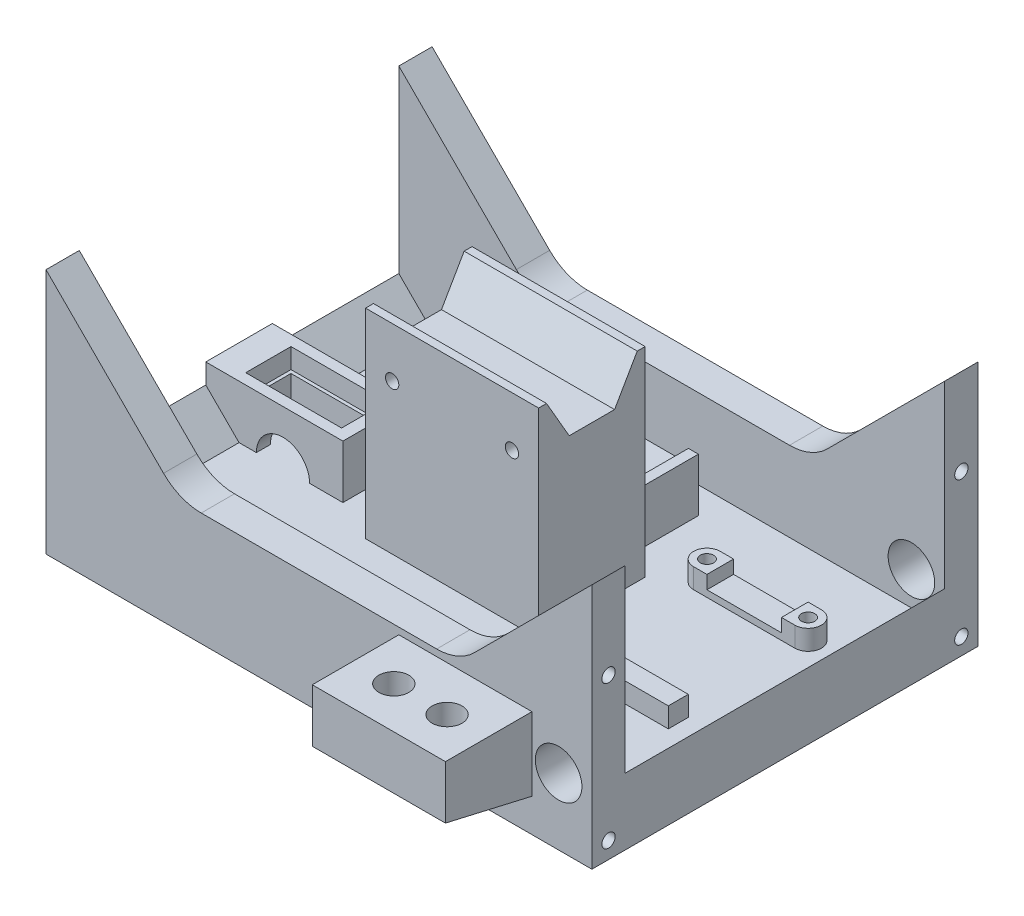
from build123d import *

# Parameters (mm, degrees)
RESSALTO_EXTRUS_O1_DEPTH  = 29
CORTE_EXTRUS_O1_REACH     = 115.6
ESBO_O2_R                 = 6.5
ESBO_O3_R                 = 18
CORTE_EXTRUS_O2_DEPTH     = 2.5
CORTE_EXTRUS_O3_START     = -5
ESBO_O5_R                 = 2
ESBO_O5_R_2               = 1.5
CORTE_EXTRUS_O3_DEPTH     = 5
ESBO_O7_R                 = 12
ESBO_O7_R_2               = 2
CORTE_EXTRUS_O4_DEPTH     = 110.590145542
ESBO_O11_W                = 18
ESBO_O11_H                = 10
RESSALTO_EXTRUS_O3_DEPTH  = 8
ESBO_O12_W                = 14.4
ESBO_O12_H                = 6.8
CORTE_EXTRUS_O6_DEPTH     = 3
ESBO_O13_W                = 13.4
ESBO_O13_H                = 5.8
CORTE_EXTRUS_O7_DEPTH     = 5
CORTE_EXTRUS_O8_REACH     = 84.898
RESSALTO_EXTRUS_O4_DEPTH  = 5
ESBO_O17_W                = 2.6
ESBO_O17_H                = 10
RESSALTO_EXTRUS_O5_DEPTH  = 8
CHANFRO1_SIZE             = 5
FILETE1_R                 = 8
ESBO_O18_W                = 20
ESBO_O18_H                = 8
RESSALTO_EXTRUS_O6_DEPTH  = 13
ESBO_O19_R                = 2.25
CORTE_EXTRUS_O9_DEPTH     = 80.252760204
CHANFRO2_SIZE             = 3
CHANFRO2_SIZE_2           = 13
CORTE_EXTRUS_O10_START    = -6
CORTE_EXTRUS_O10_DEPTH    = 74.252760204
ESBO_O21_W                = 26
ESBO_O21_H                = 16
RESSALTO_EXTRUS_O7_DEPTH  = 30
CORTE_EXTRUS_O11_DEPTH    = 26
ESBO_O24_R                = 1
ESBO_O24_W                = 17.2
ESBO_O24_H                = 3
RESSALTO_EXTRUS_O8_DEPTH  = 3
ESBO_O25_W                = 11.2
ESBO_O25_H                = 4
CORTE_EXTRUS_O12_DEPTH    = 2
ESBO_O26_R                = 3.5
CORTE_EXTRUS_O13_DEPTH    = 5
ESBO_O27_W                = 24
ESBO_O27_H                = 8
RESSALTO_EXTRUS_O9_DEPTH  = 6
ESBO_O28_W                = 1.5
ESBO_O28_H                = 8
RESSALTO_EXTRUS_O10_DEPTH = 2
ESBO_O31_R                = 1
CORTE_EXTRUS_O14_DEPTH    = 85.172442046
ESBO_O32_R                = 1
CORTE_EXTRUS_O15_DEPTH    = 12
ESBO_O33_R                = 1.25
CORTE_EXTRUS_O16_DEPTH    = 5
CORTE_EXTRUS_O17_DEPTH    = 2
ESBO_O38_R                = 62.548775677
CORTE_EXTRUS_O20_DEPTH    = 114.723348526
ESBO_O39_R                = 54.583555182
CORTE_EXTRUS_O21_DEPTH    = 110.945441015


with BuildPart() as part:
    # Esboço1 → Ressalto-extrusão1 (new, symmetric)
    with BuildSketch(Plane.XY):
        Polygon((0, 0), (-41, 0), (-41, 60), (-46, 60), (-46, -5), (46, -5), (46, 60), (41, 60), (41, 0), align=None)
    extrude(amount=RESSALTO_EXTRUS_O1_DEPTH, both=True)

    # Esboço2 → Corte-extrusão1 (cut, up to next)
    with BuildSketch(Plane.ZY.offset(46), mode=Mode.PRIVATE) as corte_extrus_o1_sk1:
        with Locations(Location((0, 30, 0), (0, 0, 270))):
            Circle(ESBO_O2_R)
    corte_extrus_o1_tool1 = extrude(corte_extrus_o1_sk1.sketch, amount=-CORTE_EXTRUS_O1_REACH, mode=Mode.PRIVATE) & part.part
    add(corte_extrus_o1_tool1.solids().sort_by_distance((-46, 30, 0))[0], mode=Mode.SUBTRACT)

    # Esboço3 → Corte-extrusão2 (cut)
    with BuildSketch(Plane.ZY.offset(46)):
        with Locations(Location((0, 30, 0), (0, 0, 270))):
            Circle(ESBO_O3_R)
    extrude(amount=-CORTE_EXTRUS_O2_DEPTH, mode=Mode.SUBTRACT)

    # Esboço5 → Corte-extrusão3 (cut)
    with BuildSketch(Plane.ZY.offset(46).offset(CORTE_EXTRUS_O3_START)):
        with Locations(Location((-15.5, 45.5, 0), (0, 0, 270))):
            Circle(ESBO_O5_R)
        with Locations(Location((0, 42, 0), (0, 0, 270))):
            Circle(ESBO_O5_R_2)
        with Locations(Location((0, 18, 0), (0, 0, 270))):
            Circle(ESBO_O5_R_2)
        with Locations(Location((0, 54, 0), (0, 0, 270))):
            Circle(ESBO_O5_R)
        with Locations(Location((15.5, 45.5, 0), (0, 0, 270))):
            Circle(ESBO_O5_R)
        with Locations(Location((15.5, 14.5, 0), (0, 0, 270))):
            Circle(ESBO_O5_R)
        with Locations(Location((-15.5, 14.5, 0), (0, 0, 270))):
            Circle(ESBO_O5_R)
        with Locations(Location((20.784609691, 18, 0), (0, 0, 270))):
            Circle(ESBO_O5_R)
        with Locations(Location((-20.784609691, 18, 0), (0, 0, 270))):
            Circle(ESBO_O5_R)
        with BuildLine():
            Line((-8, 31.5), (8, 31.5))
            ThreePointArc((8, 31.5), (9.5, 30), (8, 28.5))
            Line((8, 28.5), (-8, 28.5))
            ThreePointArc((-8, 28.5), (-9.5, 30), (-8, 31.5))
        make_face()
    extrude(amount=CORTE_EXTRUS_O3_DEPTH, mode=Mode.SUBTRACT)

    # Esboço7 → Corte-extrusão4 (cut, through all)
    with BuildSketch(Plane.ZY.offset(-41)):
        with Locations(Location((0, 30, 0), (0, 0, 270))):
            Circle(ESBO_O7_R)
        with Locations(Location((-15.5, 45.5, 0), (0, 0, 270))):
            Circle(ESBO_O7_R_2)
        with Locations(Location((15.5, 45.5, 0), (0, 0, 270))):
            Circle(ESBO_O7_R_2)
        with Locations(Location((15.5, 14.5, 0), (0, 0, 270))):
            Circle(ESBO_O7_R_2)
        with Locations(Location((-15.5, 14.5, 0), (0, 0, 270))):
            Circle(ESBO_O7_R_2)
    extrude(amount=-CORTE_EXTRUS_O4_DEPTH, mode=Mode.SUBTRACT)

    # Esboço11 → Ressalto-extrusão3 (add)
    with BuildSketch(Plane(origin=(0, 0, 0), x_dir=(1, 0, 0), z_dir=(0, 1, 0))):
        with Locations((-29.4, 0)):
            Rectangle(ESBO_O11_W, ESBO_O11_H)
    extrude(amount=RESSALTO_EXTRUS_O3_DEPTH)

    # Esboço12 → Corte-extrusão6 (cut)
    with BuildSketch(Plane(origin=(0, 8, 0), x_dir=(1, 0, 0), z_dir=(0, 1, 0))):
        with Locations((-29.4, 0)):
            Rectangle(ESBO_O12_W, ESBO_O12_H)
    extrude(amount=-CORTE_EXTRUS_O6_DEPTH, mode=Mode.SUBTRACT)

    # Esboço13 → Corte-extrusão7 (cut)
    with BuildSketch(Plane(origin=(0, 5, 0), x_dir=(1, 0, 0), z_dir=(0, 1, 0))):
        with Locations((-29.4, 0)):
            Rectangle(ESBO_O13_W, ESBO_O13_H)
    extrude(amount=-CORTE_EXTRUS_O7_DEPTH, mode=Mode.SUBTRACT)

    # Esboço14 → Corte-extrusão8 (cut, up to next)
    with BuildSketch(Plane.XY.offset(5), mode=Mode.PRIVATE) as corte_extrus_o8_sk1:
        with BuildLine():
            Line((-33.4, 0), (-25.4, 0))
            ThreePointArc((-25.4, 0), (-29.4, 4), (-33.4, 0))
        make_face()
    corte_extrus_o8_tool1 = extrude(corte_extrus_o8_sk1.sketch, amount=-CORTE_EXTRUS_O8_REACH, mode=Mode.PRIVATE) & part.part
    add(corte_extrus_o8_tool1.solids().sort_by_distance((-29.4, 1.697653, 5))[0], mode=Mode.SUBTRACT)

    # Esboço16 → Ressalto-extrusão4 (add)
    with BuildSketch(Plane.XY.offset(29)):
        Polygon((-41, 32), (-21, 12), (21, 12), (41, 32), (41, 0), (-41, 0), align=None)
    ressalto_extrus_o4 = extrude(amount=-RESSALTO_EXTRUS_O4_DEPTH)

    # Espelhar1: Ressalto-extrusão4 across plane
    add(ressalto_extrus_o4.mirror(Plane.XY))

    # Esboço17 → Ressalto-extrusão5 (add)
    with BuildSketch(Plane(origin=(0, 8, 0), x_dir=(1, 0, 0), z_dir=(0, 1, 0))):
        with Locations((-39.7, 0)):
            Rectangle(ESBO_O17_W, ESBO_O17_H)
    extrude(amount=-RESSALTO_EXTRUS_O5_DEPTH)

    # Chanfro1
    chanfro1_edges = [part.edges().sort_by_distance(p)[0] for p in [
        (41, 0, 0),
        (-41, 0, 14.5),
        (-41, 0, -14.5),
    ]]
    chamfer(chanfro1_edges, length=CHANFRO1_SIZE)

    # Filete1
    filete1_edges = [part.edges().sort_by_distance(p)[0] for p in [
        (-43.5, 60, -29),
        (-43.5, 60, 29),
        (-21, 12, 26.5),
        (21, 12, 26.5),
        (21, 12, -26.5),
        (-21, 12, -26.5),
        (43.5, 60, 29),
        (43.5, 60, -29),
    ]]
    fillet(filete1_edges, radius=FILETE1_R)

    # Esboço18 → Ressalto-extrusão6 (add)
    with BuildSketch(Plane.XY.offset(29)):
        with Locations((22, 7)):
            Rectangle(ESBO_O18_W, ESBO_O18_H)
    extrude(amount=RESSALTO_EXTRUS_O6_DEPTH)

    # Esboço19 → Corte-extrusão9 (cut, through all)
    with BuildSketch(Plane(origin=(0, 11, 0), x_dir=(1, 0, 0), z_dir=(0, 1, 0))):
        with Locations(Location((18, -35.75, 0), (0, 0, 270))):
            Circle(ESBO_O19_R)
        with Locations(Location((26, -35.75, 0), (0, 0, 270))):
            Circle(ESBO_O19_R)
    extrude(amount=-CORTE_EXTRUS_O9_DEPTH, mode=Mode.SUBTRACT)

    # Chanfro2
    # the kernel refuses this chamfer: 13, 3 mm, written as the material it adds along each edge
    with BuildSketch(Plane(origin=(12, 3, 29), x_dir=(0, -0.987043568605235, -0.1604524654688814), z_dir=(1, 0, 0))) as chanfro2_piece_1_section:
        Polygon((CHANFRO2_SIZE * 0.987043568605, -CHANFRO2_SIZE * 0.160452465469), (-CHANFRO2_SIZE_2 * 0.160452465469, -CHANFRO2_SIZE_2 * 0.987043568605), (0, 0), align=None)
    chanfro2_piece_1 = extrude(amount=20, mode=Mode.PRIVATE)
    chanfro2_piece_1 = split(chanfro2_piece_1, bisect_by=Plane(origin=(21.999997786, 2.099377296, 42), z_dir=(0, 0, -1)), keep=Keep.TOP, mode=Mode.PRIVATE)
    chanfro2_piece_1 = chanfro2_piece_1 - Plane(origin=(18, 2.099377296, 35.75), x_dir=(0, 0, 1), z_dir=(0, 1, 0)) * Cylinder(2.25, 92, mode=Mode.PRIVATE)
    chanfro2_piece_1 = chanfro2_piece_1 - Plane(origin=(26, 2.099377296, 35.75), x_dir=(0, 0, 1), z_dir=(0, 1, 0)) * Cylinder(2.25, 92, mode=Mode.PRIVATE)
    add(chanfro2_piece_1)

    # Esboço20 → Corte-extrusão10 (cut, through all)
    with BuildSketch(Plane(origin=(0, 11, 0), x_dir=(1, 0, 0), z_dir=(0, 1, 0)).offset(CORTE_EXTRUS_O10_START)):
        with BuildLine():
            Line((18, -31.5), (26, -31.5))
            ThreePointArc((26, -31.5), (30.25, -35.75), (26, -40))
            Line((26, -40), (18, -40))
            ThreePointArc((18, -40), (13.75, -35.75), (18, -31.5))
        make_face()
    extrude(amount=-CORTE_EXTRUS_O10_DEPTH, mode=Mode.SUBTRACT)

    # Esboço21 → Ressalto-extrusão7 (add)
    with BuildSketch(Plane(origin=(0, 0, 0), x_dir=(1, 0, 0), z_dir=(0, 1, 0))):
        with Locations((-1, 0)):
            Rectangle(ESBO_O21_W, ESBO_O21_H)
    extrude(amount=RESSALTO_EXTRUS_O7_DEPTH)

    # Esboço22 → Corte-extrusão11 (cut)
    with BuildSketch(Plane(origin=(12, 0, 0), x_dir=(0, 0, -1), z_dir=(1, 0, 0))):
        Polygon((6.812733176, 30), (3.406366588, 35.9), (-3.406366588, 35.9), (-6.812733176, 30), (-3.406366588, 24.1), (3.406366588, 24.1), align=None)
    extrude(amount=-CORTE_EXTRUS_O11_DEPTH, mode=Mode.SUBTRACT)

    # Esboço24 → Ressalto-extrusão8 (add)
    # profile 1 of 2: a face of its own
    with BuildSketch(Plane(origin=(0, 0, 0), x_dir=(1, 0, 0), z_dir=(0, 1, 0))):
        with BuildLine():
            Line((17.282291959, 14), (32.482291959, 14))
            ThreePointArc((32.482291959, 14), (34.482291959, 12), (32.482291959, 10))
            Line((32.482291959, 10), (17.282291959, 10))
            ThreePointArc((17.282291959, 10), (15.282291959, 12), (17.282291959, 14))
        make_face()
        with Locations(Location((17.282291959, 12, 0), (0, 0, 180))):
            Circle(ESBO_O24_R, mode=Mode.SUBTRACT)
        with Locations(Location((32.482291959, 12, 0), (0, 0, 180))):
            Circle(ESBO_O24_R, mode=Mode.SUBTRACT)
    # profile 2 of 2: a face of its own
    with BuildSketch(Plane(origin=(0, 0, 0), x_dir=(1, 0, 0), z_dir=(0, 1, 0))):
        with Locations((24.882291959, -8.5)):
            Rectangle(ESBO_O24_W, ESBO_O24_H)
    extrude(amount=RESSALTO_EXTRUS_O8_DEPTH)

    # Esboço25 → Corte-extrusão12 (cut)
    with BuildSketch(Plane(origin=(0, 3, 0), x_dir=(1, 0, 0), z_dir=(0, 1, 0))):
        with Locations((24.882291959, 12)):
            Rectangle(ESBO_O25_W, ESBO_O25_H)
    extrude(amount=-CORTE_EXTRUS_O12_DEPTH, mode=Mode.SUBTRACT)

    # Esboço26 → Corte-extrusão13 (cut)
    with BuildSketch(Plane.XY.offset(29)):
        with Locations((36, 5)):
            Circle(ESBO_O26_R)
    corte_extrus_o13 = extrude(amount=-CORTE_EXTRUS_O13_DEPTH, mode=Mode.SUBTRACT)

    # Esboço27 → Ressalto-extrusão9 (add)
    with BuildSketch(Plane(origin=(0, 0, 0), x_dir=(1, 0, 0), z_dir=(0, 1, 0))):
        with Locations((-4, 16)):
            Rectangle(ESBO_O27_W, ESBO_O27_H)
    extrude(amount=RESSALTO_EXTRUS_O9_DEPTH)

    # Esboço28 → Ressalto-extrusão10 (add)
    with BuildSketch(Plane(origin=(0, 6, 0), x_dir=(1, 0, 0), z_dir=(0, 1, 0))):
        with Locations((-15.25, 16)):
            Rectangle(ESBO_O28_W, ESBO_O28_H)
        with Locations((7.25, 16)):
            Rectangle(ESBO_O28_W, ESBO_O28_H)
    extrude(amount=RESSALTO_EXTRUS_O10_DEPTH)

    # Esboço31 → Corte-extrusão14 (cut, through all)
    with BuildSketch(Plane.XY.offset(8)):
        with Locations((-10, 22.5)):
            Circle(ESBO_O31_R)
        with Locations((8, 22.5)):
            Circle(ESBO_O31_R)
    extrude(amount=-CORTE_EXTRUS_O14_DEPTH, mode=Mode.SUBTRACT)

    # Esboço32 → Corte-extrusão15 (cut)
    with BuildSketch(Plane.ZY.offset(46)):
        with Locations(Location((-26.5, -2.5, 0), (0, 0, 270))):
            Circle(ESBO_O32_R)
        with Locations(Location((-26.5, 19, 0), (0, 0, 270))):
            Circle(ESBO_O32_R)
        with Locations(Location((26.5, 19, 0), (0, 0, 90))):
            Circle(ESBO_O32_R)
        with Locations(Location((26.5, -2.5, 0), (0, 0, 90))):
            Circle(ESBO_O32_R)
    corte_extrus_o15 = extrude(amount=-CORTE_EXTRUS_O15_DEPTH, mode=Mode.SUBTRACT)

    # Esboço33 → Corte-extrusão16 (cut)
    with BuildSketch(Plane.ZY.offset(46)):
        with Locations(Location((-26.5, -2.5, 0), (0, 0, 270))):
            Circle(ESBO_O33_R)
        with Locations(Location((-26.5, 19, 0), (0, 0, 270))):
            Circle(ESBO_O33_R)
        with Locations(Location((26.5, 19, 0), (0, 0, 90))):
            Circle(ESBO_O33_R)
        with Locations(Location((26.5, -2.5, 0), (0, 0, 90))):
            Circle(ESBO_O33_R)
    corte_extrus_o16 = extrude(amount=-CORTE_EXTRUS_O16_DEPTH, mode=Mode.SUBTRACT)

    # Esboço34 → Corte-extrusão17 (cut)
    with BuildSketch(Plane.ZY.offset(46)):
        with BuildLine():
            Line((-26.5, -0.25), (-29, -0.25))
            Line((-29, -0.25), (-29, -5))
            Line((-29, -5), (-24.25, -5))
            Line((-24.25, -5), (-24.25, -2.5))
            ThreePointArc((-24.25, -2.5), (-24.909009742, -0.909009742), (-26.5, -0.25))
        make_face()
        with BuildLine():
            Line((-26.5, 21.25), (-29, 21.25))
            Line((-29, 21.25), (-29, 16.75))
            Line((-29, 16.75), (-26.5, 16.75))
            ThreePointArc((-26.5, 16.75), (-24.25, 19), (-26.5, 21.25))
        make_face()
        with BuildLine():
            Line((29, 16.75), (29, 21.25))
            Line((29, 21.25), (26.5, 21.25))
            ThreePointArc((26.5, 21.25), (24.25, 19), (26.5, 16.75))
            Line((26.5, 16.75), (29, 16.75))
        make_face()
        with BuildLine():
            Line((29, -5), (24.25, -5))
            Line((24.25, -5), (24.25, -2.5))
            ThreePointArc((24.25, -2.5), (24.909009742, -0.909009742), (26.5, -0.25))
            Line((26.5, -0.25), (29, -0.25))
            Line((29, -0.25), (29, -5))
        make_face()
    corte_extrus_o17 = extrude(amount=-CORTE_EXTRUS_O17_DEPTH, mode=Mode.SUBTRACT)

    # Espelhar2: Corte-extrusão15, Corte-extrusão16, Corte-extrusão17 across plane
    add(corte_extrus_o15.mirror(Plane(origin=(0, 0, 0), x_dir=(0, 0, 1), z_dir=(1, 0, 0))), mode=Mode.SUBTRACT)
    add(corte_extrus_o16.mirror(Plane(origin=(0, 0, 0), x_dir=(0, 0, 1), z_dir=(1, 0, 0))), mode=Mode.SUBTRACT)
    add(corte_extrus_o17.mirror(Plane(origin=(0, 0, 0), x_dir=(0, 0, 1), z_dir=(1, 0, 0))), mode=Mode.SUBTRACT)

    # Esboço38 → Corte-extrusão20 (cut, through all)
    with BuildSketch(Plane.ZY.offset(-41)):
        with Locations((0, 30)):
            Circle(ESBO_O38_R)
    extrude(amount=-CORTE_EXTRUS_O20_DEPTH, mode=Mode.SUBTRACT)

    # Esboço39 → Corte-extrusão21 (cut, through all)
    with BuildSketch(Plane(origin=(-41, 0, 0), x_dir=(0, 0, -1), z_dir=(1, 0, 0))):
        with Locations((0, 30)):
            Circle(ESBO_O39_R)
    extrude(amount=-CORTE_EXTRUS_O21_DEPTH, mode=Mode.SUBTRACT)

    # Espelhar3: Corte-extrusão13 across plane
    add(corte_extrus_o13.mirror(Plane.XY), mode=Mode.SUBTRACT)


solid = part.part
